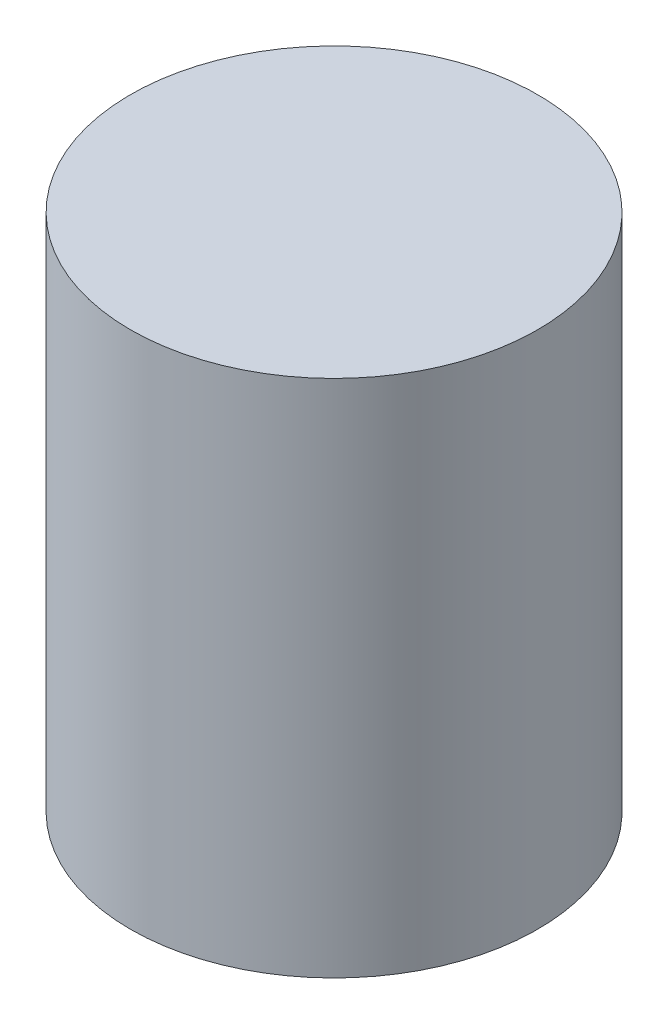
from build123d import *

# Parameters (mm, degrees)
SKETCH1_R           = 20
BOSS_EXTRUDE1_DEPTH = 51


with BuildPart() as part:
    # Sketch1 → Boss-Extrude1 (new body)
    with BuildSketch(Plane(origin=(0, 0, 0), x_dir=(1, 0, 0), z_dir=(0, 1, 0))):
        Circle(SKETCH1_R)
    extrude(amount=BOSS_EXTRUDE1_DEPTH)


solid = part.part
